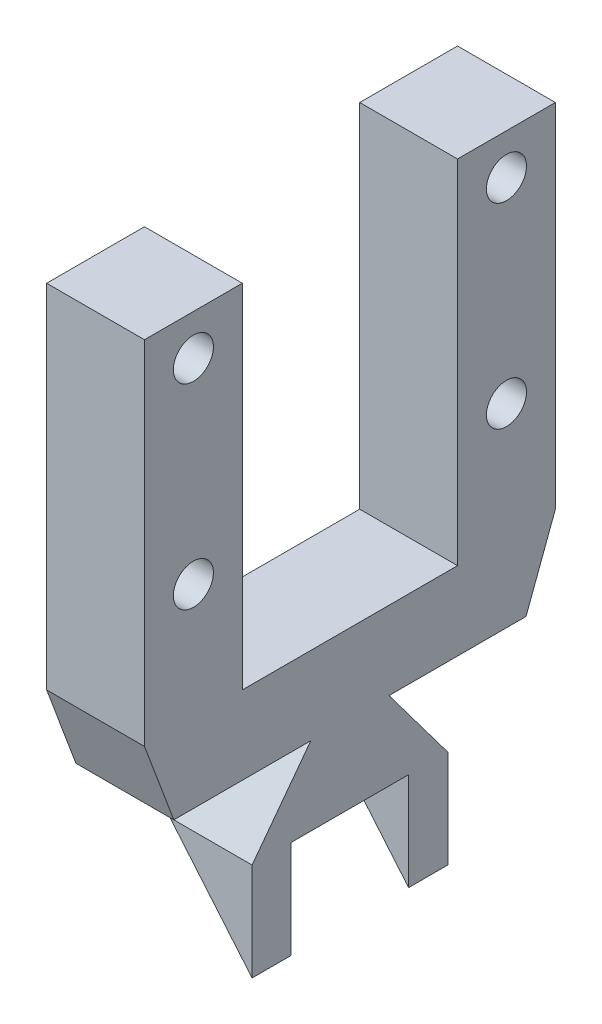
from build123d import *

# Parameters (mm, degrees)
BOSS_EXTRUDE2_DEPTH  = 6.35
BOSS_EXTRUDE4_DEPTH  = 6.35
CUT_EXTRUDE1_DEPTH   = 3.81
M2_CLEARANCE_HOLE1_D = 2.6


with BuildPart() as part:
    # Sketch5 → Boss-Extrude2 (new body)
    with BuildSketch(Plane(origin=(0, 0, 0), x_dir=(0, 0, -1), z_dir=(1, 0, 0))):
        Polygon((-6.35, 0), (6.35, 0), (2.54, 5.08), (11.43, 5.08), (13.335, 10.16), (13.335, 33.02), (6.985, 33.02), (6.985, 10.16), (-6.985, 10.16), (-6.985, 33.02), (-13.335, 33.02), (-13.335, 10.16), (-11.43, 5.08), (-2.54, 5.08), align=None)
    extrude(amount=BOSS_EXTRUDE2_DEPTH)

    # Sketch7 → Boss-Extrude4 (add, symmetric)
    with BuildSketch(Plane.XY):
        Polygon((6.35, 0), (6.35, -6.35), (1.021717342, 0), align=None)
    extrude(amount=BOSS_EXTRUDE4_DEPTH, both=True)

    # Sketch7<2> → Cut-Extrude1 (cut, symmetric)
    with BuildSketch(Plane.XY):
        Polygon((6.35, 0), (6.35, -6.35), (1.021717342, 0), align=None)
    extrude(amount=CUT_EXTRUDE1_DEPTH, both=True, mode=Mode.SUBTRACT)

    # M2 Clearance Hole1 (through all)
    with Locations(Plane(origin=(6.35, 0, 0), x_dir=(0, 0, -1), z_dir=(1, 0, 0))):
        with Locations((-10.159977629, 17.689823395), (-10.159977629, 30.389823395), (10.160022371, 30.389823395), (10.160022371, 17.689823395)):
            Hole(M2_CLEARANCE_HOLE1_D / 2)


solid = part.part
